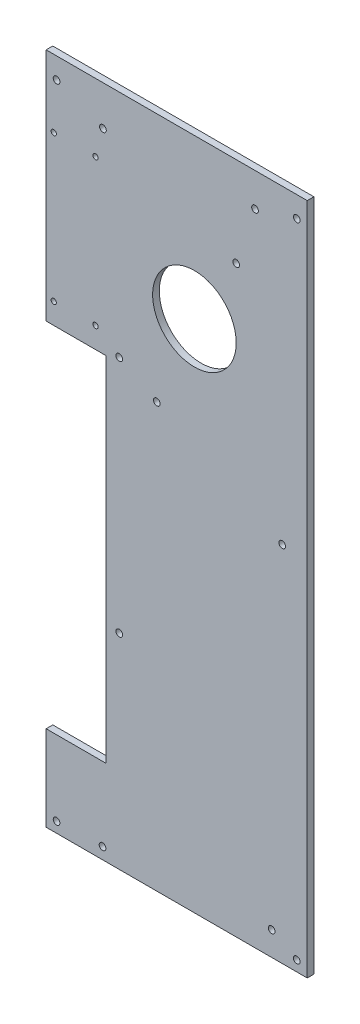
from build123d import *

# Parameters (mm, degrees)
SKETCH1_R           = 1.6
SKETCH1_R_2         = 20
SKETCH1_R_3         = 1.25
BOSS_EXTRUDE1_DEPTH = 3.18


with BuildPart() as part:
    # Sketch1 → Boss-Extrude1 (new body)
    with BuildSketch(Plane(origin=(0, 0, 0), x_dir=(0, 1, 0), z_dir=(0, 0, 1))):
        Polygon((-98, 35), (-98, -90), (224.3, -90), (224.3, 35), (111.85, 35), (111.85, 6.35), (-57.15, 6.35), (-57.15, 35), align=None)
        with Locations((-92.5, 8)):
            Circle(SKETCH1_R, mode=Mode.SUBTRACT)
        with Locations((-93, 30)):
            Circle(SKETCH1_R, mode=Mode.SUBTRACT)
        with Locations((205.3, 7.8)):
            Circle(SKETCH1_R, mode=Mode.SUBTRACT)
        with Locations((114.3, 0)):
            Circle(SKETCH1_R, mode=Mode.SUBTRACT)
        with Locations((-93, -85)):
            Circle(SKETCH1_R, mode=Mode.SUBTRACT)
        with Locations((-86.5, -73)):
            Circle(SKETCH1_R, mode=Mode.SUBTRACT)
        with Locations((75.7, -78)):
            Circle(SKETCH1_R, mode=Mode.SUBTRACT)
        with Locations((214.3, -85)):
            Circle(SKETCH1_R, mode=Mode.SUBTRACT)
        with Locations((208.3, -65)):
            Circle(SKETCH1_R, mode=Mode.SUBTRACT)
        with Locations((181.3, -56)):
            Circle(SKETCH1_R, mode=Mode.SUBTRACT)
        with Locations((148.3, -36)):
            Circle(SKETCH1_R_2, mode=Mode.SUBTRACT)
        Circle(SKETCH1_R, mode=Mode.SUBTRACT)
        with Locations((104.8, -18)):
            Circle(SKETCH1_R, mode=Mode.SUBTRACT)
        with Locations((191.85, 31.35)):
            Circle(SKETCH1_R_3, mode=Mode.SUBTRACT)
        with Locations((121.85, 11.35)):
            Circle(SKETCH1_R_3, mode=Mode.SUBTRACT)
        with Locations((121.85, 31.35)):
            Circle(SKETCH1_R_3, mode=Mode.SUBTRACT)
        with Locations((191.85, 11.35)):
            Circle(SKETCH1_R_3, mode=Mode.SUBTRACT)
        with Locations((214.3, 30)):
            Circle(SKETCH1_R, mode=Mode.SUBTRACT)
    extrude(amount=-BOSS_EXTRUDE1_DEPTH)


solid = part.part
